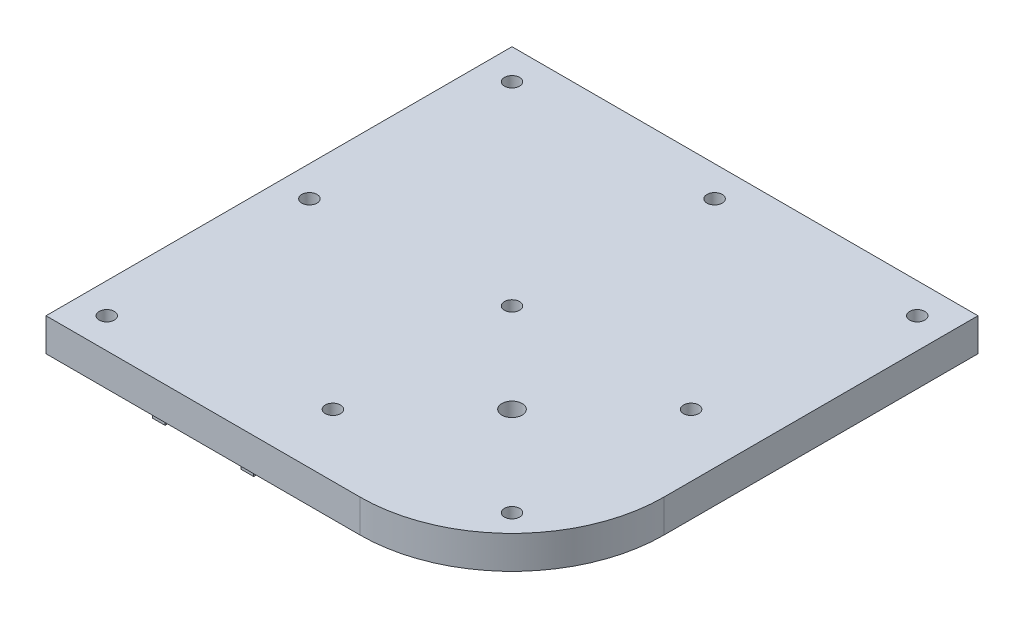
from build123d import *
from build123d.topology import SkipClean

# Parameters (mm, degrees)
EXTRUDE2_DEPTH          = 4
EXTRUDE2_DEPTH_BACK     = 2.5
SKETCH7_R               = 1.5
SKETCH7_R_2             = 2
SKETCH8_W               = 28
SKETCH8_H               = 20
EXTRUDE3_DEPTH          = 9.5
EXTRUDE6_DEPTH          = 28
SKETCH15_R              = 7.5
EXTRUDE7_DEPTH          = 25
SKETCH16_W              = 3
SKETCH16_H              = 3
SKETCH8_4_W             = 28
SKETCH8_4_H             = 20
EXTRUDE8_DEPTH          = 9.5
EXTRUDE9_DEPTH          = 28
SKETCH19_R              = 7.5
EXTRUDE10_DEPTH         = 25
SKETCH20_W              = 3
SKETCH20_H              = 3
BODY_MOVE_COPY1_ANGLE   = 180
BODY_MOVE_COPY1_2_ANGLE = 180
SKETCH22_W              = 26
SKETCH22_H              = 26
EXTRUDE11_DEPTH         = 8
SKETCH23_R              = 1.5
EXTRUDE12_DEPTH         = 26
SKETCH24_R              = 8
EXTRUDE13_DEPTH         = 8


with BuildPart() as part:
    # Sketch7 → Extrude2 (new, two sides: drawn at the far end of the back side and taken through both)
    with BuildSketch(Plane(origin=(0, 0, 0), x_dir=(1, 0, 0), z_dir=(0, 1, 0)).offset(-EXTRUDE2_DEPTH_BACK)):
        with BuildLine():
            Line((-46, -46), (16, -46))
            ThreePointArc((16, -46), (37.213203436, -37.213203436), (46, -16))
            Line((46, -16), (46, 46))
            Line((46, 46), (-46, 46))
            Line((-46, 46), (-46, -46))
        make_face()
        with Locations(Location((-1.67766953, 1.67766953, 0), (0, 0, 270))):
            Circle(SKETCH7_R, mode=Mode.SUBTRACT)
        with Locations(Location((-40, 40, 0), (0, 0, 270))):
            Circle(SKETCH7_R, mode=Mode.SUBTRACT)
        with Locations(Location((-40, -40, 0), (0, 0, 270))):
            Circle(SKETCH7_R, mode=Mode.SUBTRACT)
        with Locations(Location((40, 40, 0), (0, 0, 270))):
            Circle(SKETCH7_R, mode=Mode.SUBTRACT)
        with Locations(Location((0, 40, 0), (0, 0, 270))):
            Circle(SKETCH7_R, mode=Mode.SUBTRACT)
        with Locations(Location((-40, 0, 0), (0, 0, 270))):
            Circle(SKETCH7_R, mode=Mode.SUBTRACT)
        with Locations(Location((16, -16, 0), (0, 0, 270))):
            Circle(SKETCH7_R_2, mode=Mode.SUBTRACT)
        with Locations(Location((33.67766953, 1.67766953, 0), (0, 0, 270))):
            Circle(SKETCH7_R, mode=Mode.SUBTRACT)
        with Locations(Location((33.67766953, -33.67766953, 0), (0, 0, 270))):
            Circle(SKETCH7_R, mode=Mode.SUBTRACT)
        with Locations(Location((-1.67766953, -33.67766953, 0), (0, 0, 270))):
            Circle(SKETCH7_R, mode=Mode.SUBTRACT)
    extrude(amount=EXTRUDE2_DEPTH + EXTRUDE2_DEPTH_BACK)


with BuildPart() as body_2:
    # Sketch8 → Extrude3 (new body)
    with BuildSketch(Plane(origin=(0, 4, 0), x_dir=(1, 0, 0), z_dir=(0, 1, 0))):
        with Locations((-23, 24)):
            Rectangle(SKETCH8_W, SKETCH8_H)
    extrude(amount=EXTRUDE3_DEPTH)

    # Sketch10 → Extrude6 (cut)
    with BuildSketch(Plane(origin=(-9, 0, 0), x_dir=(0, 0, -1), z_dir=(1, 0, 0))):
        with BuildLine():
            Line((31.5, 13.5), (24, 13.5))
            Line((24, 13.5), (16.5, 13.5))
            ThreePointArc((16.5, 13.5), (17.126403912, 10.499387259), (18.900980486, 8))
            Line((18.900980486, 8), (29.099019514, 8))
            ThreePointArc((29.099019514, 8), (30.873596088, 10.499387259), (31.5, 13.5))
        make_face()
    extrude(amount=-EXTRUDE6_DEPTH, mode=Mode.SUBTRACT)

    # Sketch15 → Extrude7 (cut)
    with SkipClean():  # the faces are left unmerged after this step: merging them gives an invalid solid
        with BuildSketch(Plane.ZY.offset(35.5)):
            with Locations((-24, 13.5)):
                Circle(SKETCH15_R)
        extrude(amount=-EXTRUDE7_DEPTH, mode=Mode.SUBTRACT)


with BuildPart() as cut_sweep1_tool:
    # Cut-Sweep1: sweep along a path in Sketch17
    with SkipClean():  # the faces are left unmerged after this step: merging them gives an invalid solid
        with BuildLine(Plane(origin=(-23, 0, 0), x_dir=(0, 0, -1), z_dir=(1, 0, 0))) as cut_sweep1_path:
            CenterArc((24, 13.5), 12.806248475, 0, 360)
        # Sketch16 → Cut-Sweep1 (sweep)
        with BuildSketch(Plane.XY.offset(-14)):
            with Locations((-23, 5.5)):
                Rectangle(SKETCH16_W, SKETCH16_H)
        sweep(path=cut_sweep1_path.line)


with BuildPart() as part_1:
    with SkipClean():  # the faces are left unmerged after this step: merging them gives an invalid solid
        add(part.part)

        # Cut-Sweep1: cut by cut_sweep1_tool
        add(cut_sweep1_tool.part, mode=Mode.SUBTRACT)

    # Sketch8<4> → Extrude8 (add)
    with BuildSketch(Plane(origin=(0, 4, 0), x_dir=(1, 0, 0), z_dir=(0, 1, 0))):
        with Locations((23, 24)):
            Rectangle(SKETCH8_4_W, SKETCH8_4_H)
    extrude(amount=EXTRUDE8_DEPTH)

    # Sketch18 → Extrude9 (cut)
    with BuildSketch(Plane(origin=(37, 0, 0), x_dir=(0, 0, -1), z_dir=(1, 0, 0))):
        with BuildLine():
            Line((18.900980486, 8), (29.099019514, 8))
            ThreePointArc((29.099019514, 8), (30.873596088, 10.499387259), (31.5, 13.5))
            Line((31.5, 13.5), (16.5, 13.5))
            ThreePointArc((16.5, 13.5), (17.126403912, 10.499387259), (18.900980486, 8))
        make_face()
    extrude(amount=-EXTRUDE9_DEPTH, mode=Mode.SUBTRACT)

    # Sketch19 → Extrude10 (cut)
    with BuildSketch(Plane(origin=(35.5, 0, 0), x_dir=(0, 0, -1), z_dir=(1, 0, 0))):
        with Locations((24, 13.5)):
            Circle(SKETCH19_R)
    extrude(amount=-EXTRUDE10_DEPTH, mode=Mode.SUBTRACT)

    # Cut-Sweep2: sweep along a path in Sketch21
    with BuildLine(Plane(origin=(23, 0, 0), x_dir=(0, 0, -1), z_dir=(1, 0, 0))) as cut_sweep2_path:
        CenterArc((24, 13.5), 12.806248475, 0, 360)
    # Sketch20 → Cut-Sweep2 (sweep, cut)
    with BuildSketch(Plane.XY.offset(-14)):
        with Locations((23, 5.5)):
            Rectangle(SKETCH20_W, SKETCH20_H)
    sweep(path=cut_sweep2_path.line, mode=Mode.SUBTRACT)


with BuildPart() as body_2_1:
    with SkipClean():  # the faces are left unmerged after this step: merging them gives an invalid solid
        add(body_2.part)

        # Cut-Sweep1: cut by cut_sweep1_tool
        add(cut_sweep1_tool.part, mode=Mode.SUBTRACT)


with BuildPart() as body_2_2:
    # Body-Move/Copy1: read off the stored shape, not the designer's step
    # Body-Move/Copy1: moved
    add(body_2_1.part.rotate(Axis((0, 0, 0), (0.7071067812, 0, 0.7071067812)), BODY_MOVE_COPY1_ANGLE))


with BuildPart() as part_2:
    # Body-Move_Copy1 2: moved
    add(part_1.part.rotate(Axis((0, 0, 0), (0.7071067812, 0, 0.7071067812)), BODY_MOVE_COPY1_2_ANGLE))

    # Sketch22 → Extrude11 (add)
    with BuildSketch(Plane.XZ.offset(4)):
        with Locations((16, 16)):
            Rectangle(SKETCH22_W, SKETCH22_H)
    extrude(amount=EXTRUDE11_DEPTH)

    # Sketch23 → Extrude12 (cut)
    with BuildSketch(Plane(origin=(29, 0, 0), x_dir=(0, 0, -1), z_dir=(1, 0, 0))):
        with Locations(Location((-22, -8, 0), (0, 0, 90))):
            Circle(SKETCH23_R)
        with Locations(Location((-10, -8, 0), (0, 0, 90))):
            Circle(SKETCH23_R)
    extrude(amount=-EXTRUDE12_DEPTH, mode=Mode.SUBTRACT)

    # Sketch24 → Extrude13 (cut)
    with BuildSketch(Plane.XZ.offset(12)):
        with Locations((16, 16)):
            Circle(SKETCH24_R)
    extrude(amount=-EXTRUDE13_DEPTH, mode=Mode.SUBTRACT)


solid = Compound([body_2_2.part, part_2.part])
